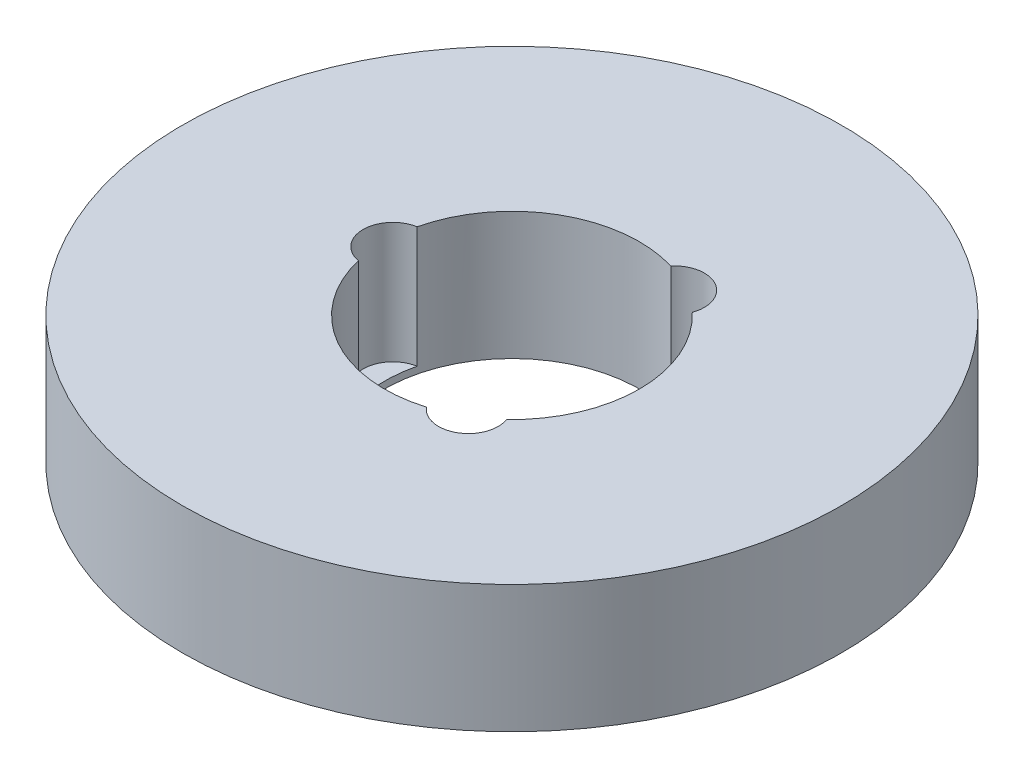
from build123d import *

# Parameters (mm, degrees)
SKETCH1_R           = 77.5
BOSS_EXTRUDE1_DEPTH = 30
SKETCH2_R           = 30
CUT_EXTRUDE1_DEPTH  = 114.633181774
SKETCH3_R           = 7.008523817
CUT_EXTRUDE2_DEPTH  = 28.39977362
CIRPATTERN1_COUNT   = 3


with BuildPart() as part:
    # Sketch1 → Boss-Extrude1 (new body)
    with BuildSketch(Plane(origin=(0, 0, 0), x_dir=(1, 0, 0), z_dir=(0, 1, 0))):
        Circle(SKETCH1_R)
    extrude(amount=BOSS_EXTRUDE1_DEPTH)

    # Sketch2 → Cut-Extrude1 (cut, through all)
    with BuildSketch(Plane(origin=(0, 0, 0), x_dir=(1, 0, 0), z_dir=(0, 1, 0))):
        Circle(SKETCH2_R)
    extrude(amount=CUT_EXTRUDE1_DEPTH, mode=Mode.SUBTRACT)

    # Sketch3 → Cut-Extrude2 (cut)
    with BuildSketch(Plane(origin=(0, 30, 0), x_dir=(1, 0, 0), z_dir=(0, 1, 0))):
        with Locations((-27.989283613, 0)):
            Circle(SKETCH3_R)
    cut_extrude2 = extrude(amount=-CUT_EXTRUDE2_DEPTH, mode=Mode.SUBTRACT)

    # CirPattern1: Cut-Extrude2 ×3 about axis
    cirpattern1_axis = Axis((0, 0, 0), (0, 1, 0))
    for i in range(1, CIRPATTERN1_COUNT):
        add(cut_extrude2.rotate(cirpattern1_axis, i * 360 / CIRPATTERN1_COUNT), mode=Mode.SUBTRACT)


solid = part.part
